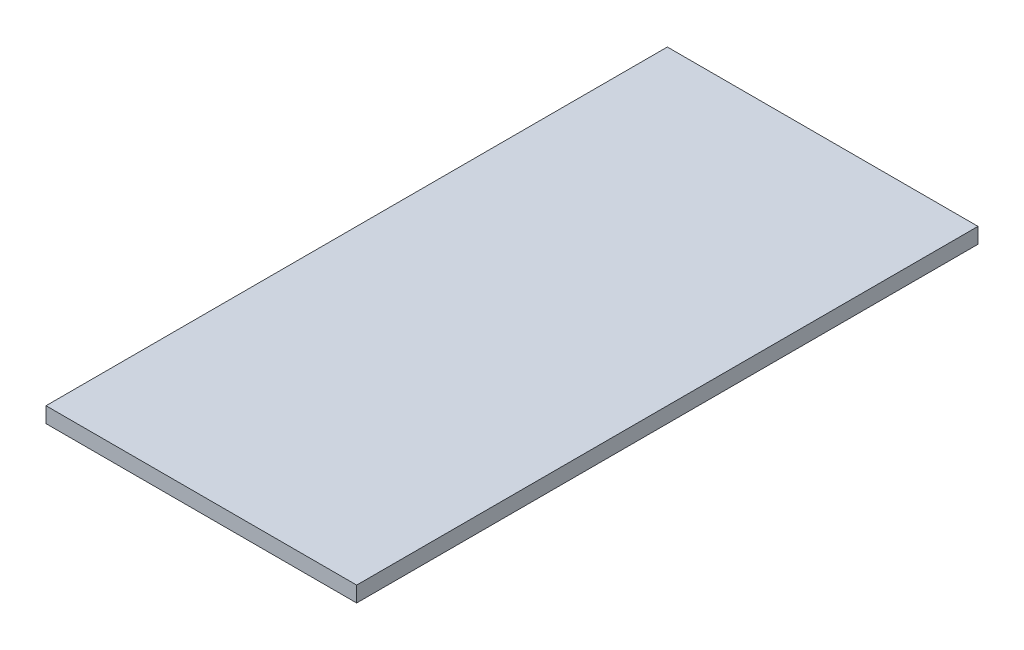
from build123d import *

# Parameters (mm, degrees)
SKETCH1_W           = 100
SKETCH1_H           = 200
BOSS_EXTRUDE1_DEPTH = 5


with BuildPart() as part:
    # Sketch1 → Boss-Extrude1 (new body)
    with BuildSketch(Plane(origin=(0, 0, 0), x_dir=(1, 0, 0), z_dir=(0, 1, 0))):
        Rectangle(SKETCH1_W, SKETCH1_H)
    extrude(amount=BOSS_EXTRUDE1_DEPTH)


solid = part.part
